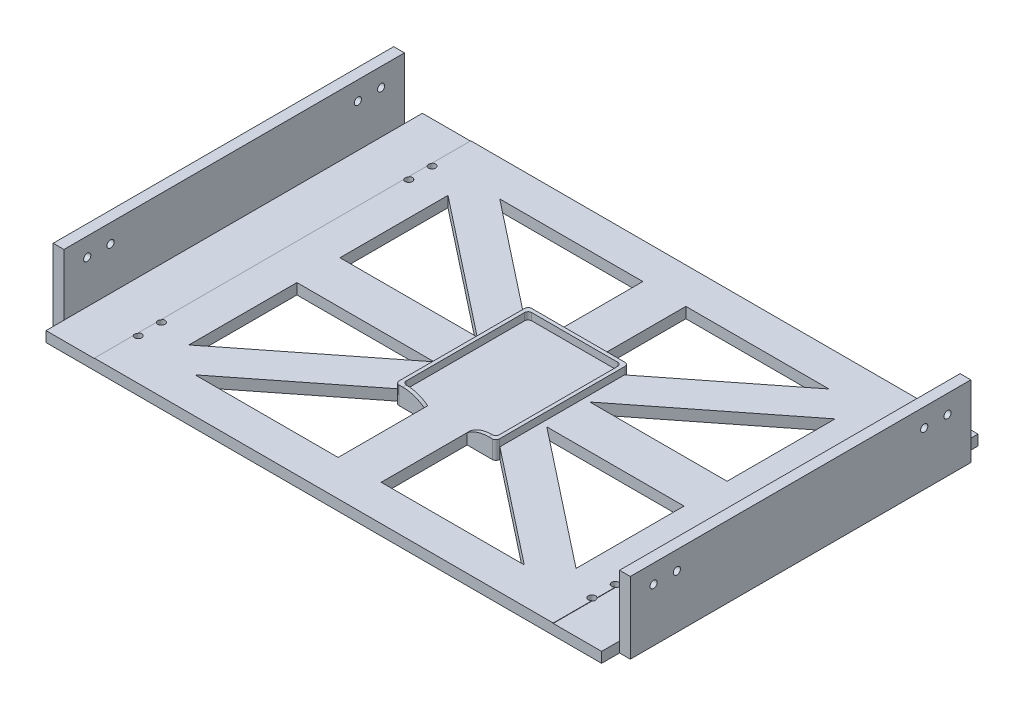
from build123d import *

# Parameters (mm, degrees)
SKETCH1_W                                  = 128
SKETCH1_H                                  = 105
BOSS_EXTRUDE1_DEPTH                        = 3
SKETCH2_W                                  = 13.5
SKETCH2_H                                  = 105
BOSS_EXTRUDE2_DEPTH                        = 2.9
BOSS_EXTRUDE9_DEPTH                        = 7
FILLET2_R                                  = 1
CUT_EXTRUDE1_DEPTH                         = 7
SKETCH3_W                                  = 3
SKETCH3_H                                  = 95
BOSS_EXTRUDE10_DEPTH                       = 20
SKETCH11_R                                 = 1
CUT_EXTRUDE2_DEPTH                         = 20
SKETCH13_R                                 = 1
CUT_EXTRUDE3_DEPTH                         = 20
MIRROR1_AT_THE_SECOND_PLANE_COPY_1_SKETC_R = 1
MIRROR1_AT_THE_SECOND_PLANE_COPY_1_DEPTH   = 20
CUT_EXTRUDE8_DEPTH                         = 5
FILLET3_R                                  = 10


with BuildPart() as part:
    # Sketch1 → Boss-Extrude1 (new body)
    with BuildSketch(Plane(origin=(0, 0, 0), x_dir=(1, 0, 0), z_dir=(0, 1, 0))):
        Rectangle(SKETCH1_W, SKETCH1_H)
    extrude(amount=BOSS_EXTRUDE1_DEPTH)

    # Sketch2 → Boss-Extrude2 (add)
    with BuildSketch(Plane(origin=(0, 0, 0), x_dir=(1, 0, 0), z_dir=(0, 1, 0))):
        with Locations((-70.75, 0)):
            Rectangle(SKETCH2_W, SKETCH2_H)
        with Locations((70.75, 0)):
            Rectangle(SKETCH2_W, SKETCH2_H)
    extrude(amount=BOSS_EXTRUDE2_DEPTH)

    # Sketch5 → Boss-Extrude9 (add)
    with BuildSketch(Plane(origin=(0, 3, 0), x_dir=(1, 0, 0), z_dir=(0, 1, 0))):
        Polygon((-6, -18.5), (-6, -17.5), (-13, -17.5), (-13, 17.5), (13, 17.5), (13, -17.5), (6, -17.5), (6, -18.5), (14, -18.5), (14, 18.5), (-14, 18.5), (-14, -18.5), align=None)
    extrude(amount=BOSS_EXTRUDE9_DEPTH)

    # Fillet2
    fillet2_edges = [part.edges().sort_by_distance(p)[0] for p in [
        (13, 6.5, 17.5),
        (14, 6.5, 18.5),
        (14, 6.5, -18.5),
        (-14, 6.5, -18.5),
        (-14, 6.5, 18.5),
        (-13, 6.5, 17.5),
        (-13, 6.5, -17.5),
        (13, 6.5, -17.5),
    ]]
    fillet(fillet2_edges, radius=FILLET2_R)

    # Sketch10 → Cut-Extrude1 (cut)
    with BuildSketch(Plane(origin=(0, 3, 0), x_dir=(1, 0, 0), z_dir=(0, 1, 0))):
        with BuildLine():
            Line((-14, -17.381354556), (-45.915455387, -42.5))
            Line((-45.915455387, -42.5), (-6, -42.5))
            Line((-6, -42.5), (-6, -18.5))
            Line((-6, -18.5), (-13, -18.5))
            ThreePointArc((-13, -18.5), (-13.707106781, -18.207106781), (-14, -17.5))
            Line((-14, -17.5), (-14, -17.381354556))
        make_face()
        Polygon((-54, -6), (-54, -36.137163962), (-15.708074024, -6), align=None)
        with BuildLine():
            Line((6, -18.5), (6, -42.5))
            Line((6, -42.5), (45.915455387, -42.5))
            Line((45.915455387, -42.5), (14, -17.381354556))
            Line((14, -17.381354556), (14, -17.5))
            ThreePointArc((14, -17.5), (13.707106781, -18.207106781), (13, -18.5))
            Line((13, -18.5), (6, -18.5))
        make_face()
        Polygon((-54, 36.137163962), (-54, 6), (-15.708074024, 6), align=None)
        Polygon((15.708074024, -6), (54, -36.137163962), (54, -6), align=None)
        with BuildLine():
            Line((-6, 42.5), (-45.915455387, 42.5))
            Line((-45.915455387, 42.5), (-14, 17.381354556))
            Line((-14, 17.381354556), (-14, 17.5))
            ThreePointArc((-14, 17.5), (-13.707106781, 18.207106781), (-13, 18.5))
            Line((-13, 18.5), (-6, 18.5))
            Line((-6, 18.5), (-6, 42.5))
        make_face()
        Polygon((15.708074024, 6), (54, 6), (54, 36.137163962), align=None)
        with BuildLine():
            Line((45.915455387, 42.5), (6, 42.5))
            Line((6, 42.5), (6, 18.5))
            Line((6, 18.5), (13, 18.5))
            ThreePointArc((13, 18.5), (13.707106781, 18.207106781), (14, 17.5))
            Line((14, 17.5), (14, 17.381354556))
            Line((14, 17.381354556), (45.915455387, 42.5))
        make_face()
    extrude(amount=-CUT_EXTRUDE1_DEPTH, mode=Mode.SUBTRACT)

    # Sketch3 → Boss-Extrude10 (add)
    with BuildSketch(Plane(origin=(0, 0, 0), x_dir=(1, 0, 0), z_dir=(0, 1, 0))):
        with Locations((-79, 0)):
            Rectangle(SKETCH3_W, SKETCH3_H)
        with Locations((79, 0)):
            Rectangle(SKETCH3_W, SKETCH3_H)
    extrude(amount=BOSS_EXTRUDE10_DEPTH)

    # Sketch11 → Cut-Extrude2 (cut)
    with BuildSketch(Plane(origin=(0, 3, 0), x_dir=(1, 0, 0), z_dir=(0, 1, 0))):
        with Locations(Location((-63.3, -41, 0), (0, 0, 270))):
            Circle(SKETCH11_R)
        with Locations(Location((-63.3, -34.5, 0), (0, 0, 270))):
            Circle(SKETCH11_R)
        with Locations(Location((-63.3, 34.5, 0), (0, 0, 270))):
            Circle(SKETCH11_R)
        with Locations(Location((-63.3, 41, 0), (0, 0, 270))):
            Circle(SKETCH11_R)
        with Locations(Location((63.3, 41, 0), (0, 0, 270))):
            Circle(SKETCH11_R)
        with Locations(Location((63.3, 34.5, 0), (0, 0, 270))):
            Circle(SKETCH11_R)
        with Locations(Location((63.3, -34.5, 0), (0, 0, 270))):
            Circle(SKETCH11_R)
        with Locations(Location((63.3, -41, 0), (0, 0, 270))):
            Circle(SKETCH11_R)
    extrude(amount=-CUT_EXTRUDE2_DEPTH, mode=Mode.SUBTRACT)

    # Sketch13 → Cut-Extrude3 (cut)
    with BuildSketch(Plane(origin=(-77.5, 0, 0), x_dir=(0, 0, -1), z_dir=(1, 0, 0))):
        with Locations((-41, 14.842473729)):
            Circle(SKETCH13_R)
        with Locations((-34.5, 14.842473729)):
            Circle(SKETCH13_R)
    cut_extrude3 = extrude(amount=-CUT_EXTRUDE3_DEPTH, mode=Mode.SUBTRACT)

    # Mirror1: Cut-Extrude3 across plane
    add(cut_extrude3.mirror(Plane.XY), mode=Mode.SUBTRACT)

    # Mirror1 at the second plane: Cut-Extrude3 across plane
    add(cut_extrude3.mirror(Plane(origin=(0, 0, 0), x_dir=(0, 0, 1), z_dir=(1, 0, 0))), mode=Mode.SUBTRACT)

    # Mirror1 at the second plane copy 1 sketc → Mirror1 at the second plane copy 1 (cut)
    with BuildSketch(Plane.ZY.offset(-77.5)):
        with Locations((-41, 14.842473729)):
            Circle(MIRROR1_AT_THE_SECOND_PLANE_COPY_1_SKETC_R)
        with Locations((-34.5, 14.842473729)):
            Circle(MIRROR1_AT_THE_SECOND_PLANE_COPY_1_SKETC_R)
    extrude(amount=-MIRROR1_AT_THE_SECOND_PLANE_COPY_1_DEPTH, mode=Mode.SUBTRACT)

    # Sketch22 → Cut-Extrude8 (cut)
    with BuildSketch(Plane(origin=(0, 10, 0), x_dir=(1, 0, 0), z_dir=(0, 1, 0))):
        with BuildLine():
            Line((14, -17.5), (14, 17.5))
            ThreePointArc((14, 17.5), (13.707106781, 18.207106781), (13, 18.5))
            Line((13, 18.5), (-13, 18.5))
            ThreePointArc((-13, 18.5), (-13.707106781, 18.207106781), (-14, 17.5))
            Line((-14, 17.5), (-14, -17.5))
            ThreePointArc((-14, -17.5), (-13.707106781, -18.207106781), (-13, -18.5))
            Line((-13, -18.5), (-6, -18.5))
            Line((-6, -18.5), (-6, -17.5))
            Line((-6, -17.5), (-12, -17.5))
            ThreePointArc((-12, -17.5), (-12.707106781, -17.207106781), (-13, -16.5))
            Line((-13, -16.5), (-13, 16.5))
            ThreePointArc((-13, 16.5), (-12.707106781, 17.207106781), (-12, 17.5))
            Line((-12, 17.5), (12, 17.5))
            ThreePointArc((12, 17.5), (12.707106781, 17.207106781), (13, 16.5))
            Line((13, 16.5), (13, -16.5))
            ThreePointArc((13, -16.5), (12.707106781, -17.207106781), (12, -17.5))
            Line((12, -17.5), (6, -17.5))
            Line((6, -17.5), (6, -18.5))
            Line((6, -18.5), (13, -18.5))
            ThreePointArc((13, -18.5), (13.707106781, -18.207106781), (14, -17.5))
        make_face()
    extrude(amount=-CUT_EXTRUDE8_DEPTH, mode=Mode.SUBTRACT)

    # Fillet3
    # the kernel refuses this fillet: 10 mm, written as the material it takes off along each edge
    with BuildSketch(Plane(origin=(6, 5, 2.5), x_dir=(0, -1, 0), z_dir=(0, 0, 1)), Plane(origin=(-6, 5, 33.5), x_dir=(0, -1, 0), z_dir=(0, 0, -1))) as fillet3_piece_1:
        with BuildLine():
            CenterArc((10, 6), FILLET3_R, 180, 36.869897646)
            Line((0, 6), (-0.2, 6))
            Line((-0.2, 6), (-0.2, 0))
            Line((-0.2, 0), (0, -0.2))
            ThreePointArc((0, -0.2), (1, -0.2), (1.84, -0.12))
            Line((1.84, -0.12), (2, 0))
        make_face()
    extrude(amount=31, mode=Mode.SUBTRACT)


solid = part.part
